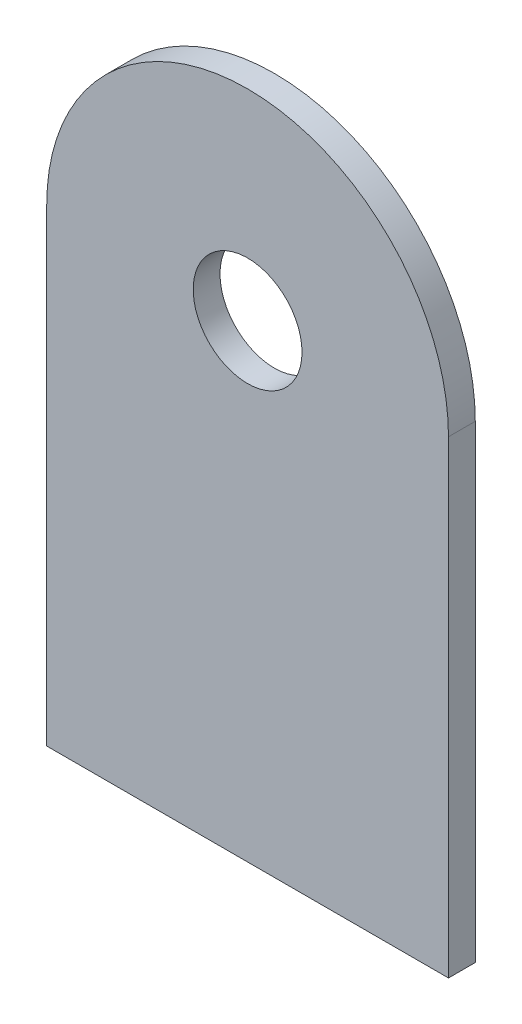
from build123d import *

# Parameters (mm, degrees)
BOSS_EXTRUDE1_DEPTH = 1.27
SKETCH3_R           = 2.5796875
CUT_EXTRUDE1_DEPTH  = 2.54


with BuildPart() as part:
    # Sketch2 → Boss-Extrude1 (new body)
    with BuildSketch(Plane.XY):
        with BuildLine():
            Line((-7.527351351, -8.25447912), (11.522648649, -8.25447912))
            Line((11.522648649, -8.25447912), (11.522648649, 13.97052088))
            ThreePointArc((11.522648649, 13.97052088), (1.997648649, 23.49552088), (-7.527351351, 13.97052088))
            Line((-7.527351351, 13.97052088), (-7.527351351, -8.25447912))
        make_face()
    extrude(amount=BOSS_EXTRUDE1_DEPTH)

    # Sketch3 → Cut-Extrude1 (cut)
    with BuildSketch(Plane.XY.offset(1.27)):
        with Locations((1.997648649, 13.97052088)):
            Circle(SKETCH3_R)
    extrude(amount=-CUT_EXTRUDE1_DEPTH, mode=Mode.SUBTRACT)


solid = part.part
